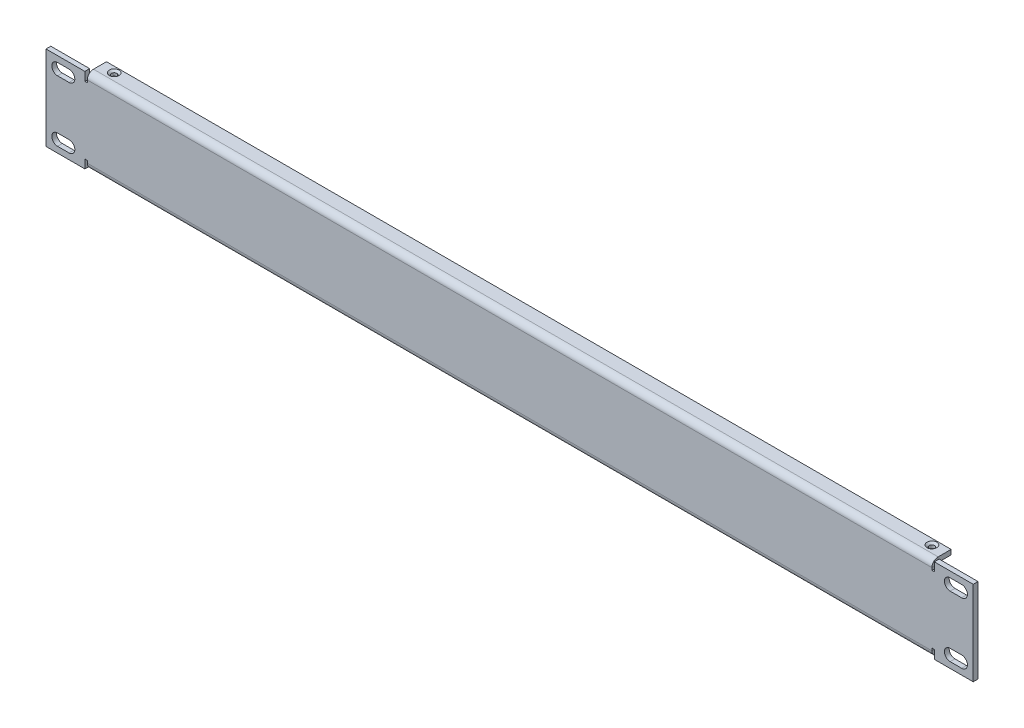
from build123d import *

# Parameters (mm, degrees)
SKETCH1_W                                         = 241.5
SKETCH1_H                                         = 22
BASE_FLANGE1_DEPTH                                = 2.5
EDGE_FLANGE1_STRIP_W                              = 11.4732
EDGE_FLANGE1_STRIP_H                              = 2.5
EDGE_FLANGE1_STRIP_CUT_DEPTH                      = 220
EDGE_FLANGE1_RELIEF_W                             = 12.7232
EDGE_FLANGE1_RELIEF_H                             = 1.25
EDGE_FLANGE1_RELIEF_CUT_DEPTH                     = 2.5
EDGE_FLANGE1_DEPTH                                = 220
CUT_EXTRUDE1_DEPTH                                = 2.5
CSK_FOR_3_FLAT_HEAD_MACHINE_SCREW_100_D           = 2.794
CSK_FOR_3_FLAT_HEAD_MACHINE_SCREW_100_CSINK_D     = 5.0546
CSK_FOR_3_FLAT_HEAD_MACHINE_SCREW_100_CSINK_ANGLE = 100


# Sheet-metal steps are written as plain solids
with BuildPart() as part:
    # Sketch1 → Base-Flange1 (new body)
    with BuildSketch(Plane.XY):
        with Locations((-120.75, 11)):
            Rectangle(SKETCH1_W, SKETCH1_H)
    extrude(amount=-BASE_FLANGE1_DEPTH)

    # Edge-Flange1 strip (across the edge) → Edge-Flange1 strip cut (cut)
    with BuildSketch(Plane(origin=(-220, 22, -2.5), x_dir=(0, -1, 0), z_dir=(1, 0, 0))):
        with Locations((-2.5, -1.25)):
            Rectangle(EDGE_FLANGE1_STRIP_W, EDGE_FLANGE1_STRIP_H)
    extrude(amount=EDGE_FLANGE1_STRIP_CUT_DEPTH, mode=Mode.SUBTRACT)

    # Edge-Flange1 relief (on the sheet) → Edge-Flange1 relief cut (cut)
    with BuildSketch(Plane(origin=(-220, 18.7634, -2.5), x_dir=(0, -1, 0), z_dir=(0, 0, -1))):
        with Locations((-5.1116, 0.625)):
            Rectangle(EDGE_FLANGE1_RELIEF_W, EDGE_FLANGE1_RELIEF_H)
    extrude(amount=-EDGE_FLANGE1_RELIEF_CUT_DEPTH, mode=Mode.SUBTRACT)

    # Edge-Flange1 section (across the edge) → Edge-Flange1 (add)
    with BuildSketch(Plane(origin=(-220, 22, -2.5), x_dir=(0, -1, 0), z_dir=(1, 0, 0))):
        with BuildLine():
            Line((0, 0.7366), (0, 7.5))
            Line((0, 7.5), (2.5, 7.5))
            Line((2.5, 7.5), (2.5, 0.7366))
            ThreePointArc((2.5, 0.7366), (2.715745145, 0.215745145), (3.2366, 0))
            Line((3.2366, 0), (3.2366, -2.5))
            ThreePointArc((3.2366, -2.5), (0.947978192, -1.552021808), (0, 0.7366))
        make_face()
    extrude(amount=EDGE_FLANGE1_DEPTH)

    # Sketch13 → Cut-Extrude1 (cut)
    with BuildSketch(Plane.XY):
        with BuildLine():
            Line((-235.5, 18.9), (-229.5, 18.9))
            ThreePointArc((-229.5, 18.9), (-226.5, 15.9), (-229.5, 12.9))
            Line((-229.5, 12.9), (-235.5, 12.9))
            ThreePointArc((-235.5, 12.9), (-238.5, 15.9), (-235.5, 18.9))
        make_face()
    extrude(amount=-CUT_EXTRUDE1_DEPTH, mode=Mode.SUBTRACT)

    # CSK for #3 Flat Head Machine Screw (100)1 (through all)
    with Locations(Plane(origin=(0, 22, 0), x_dir=(1, 0, 0), z_dir=(0, 1, 0))):
        with Locations((-213, 7)):
            CounterSinkHole(CSK_FOR_3_FLAT_HEAD_MACHINE_SCREW_100_D / 2, CSK_FOR_3_FLAT_HEAD_MACHINE_SCREW_100_CSINK_D / 2, counter_sink_angle=CSK_FOR_3_FLAT_HEAD_MACHINE_SCREW_100_CSINK_ANGLE)

    # Mirror1: part across plane


with BuildPart() as part_1:
    add(part.part)
    add(part.part.mirror(Plane(origin=(0, 0, -2.5), x_dir=(0, 0, 1), z_dir=(1, 0, 0))))

    # Mirror2: part across face


with BuildPart() as part_2:
    add(part_1.part)
    add(part_1.part.mirror(Plane(origin=(0, 0, -1.25), x_dir=(0, 0, 1), z_dir=(0, -1, 0))))


solid = part_2.part
